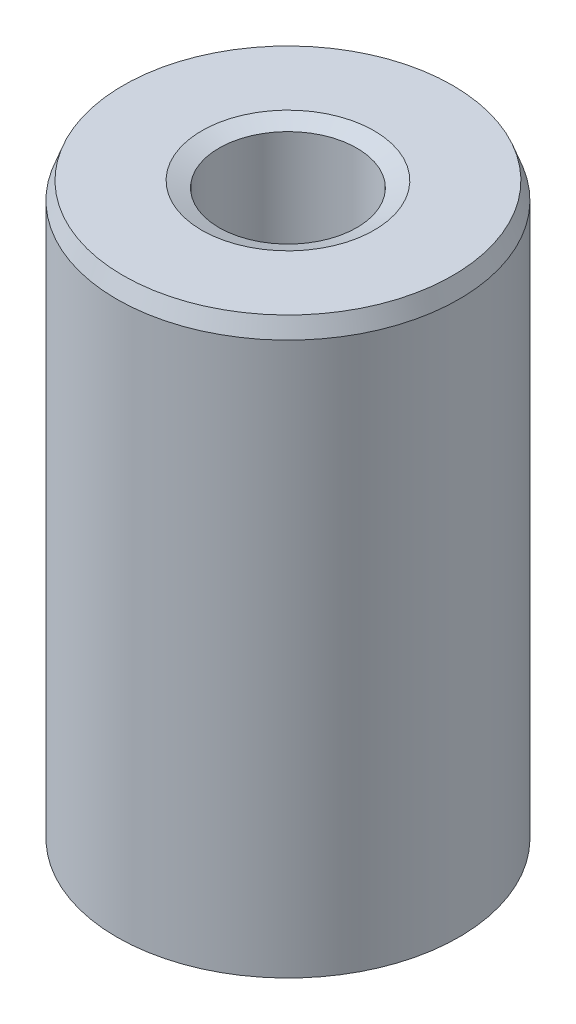
from build123d import *
from OCP.BRepFilletAPI import BRepFilletAPI_MakeChamfer

# Parameters (mm, degrees)
SKETCH1_R           = 25
BOSS_EXTRUDE1_DEPTH = 84.1594414
SKETCH2_R           = 10.069195324
CUT_EXTRUDE1_DEPTH  = 92.284235094
CHAMFER1_SIZE       = 2.524164909
CHAMFER1_SIZE2      = 0.931059133


with BuildPart() as part:
    # Sketch1 → Boss-Extrude1 (new body)
    with BuildSketch(Plane(origin=(0, 0, 0), x_dir=(1, 0, 0), z_dir=(0, 1, 0))):
        Circle(SKETCH1_R)
    extrude(amount=BOSS_EXTRUDE1_DEPTH)

    # Sketch2 → Cut-Extrude1 (cut, through all)
    with BuildSketch(Plane(origin=(0, 0, 0), x_dir=(1, 0, 0), z_dir=(0, 1, 0))):
        Circle(SKETCH2_R)
    extrude(amount=CUT_EXTRUDE1_DEPTH, mode=Mode.SUBTRACT)

    # Chamfer1: one chamfer whose edges measure the first distance from different faces: ONE call of the kernel's chamfer builder (chamfer() names one face for all edges)
    chamfer1_edges_1 = [part.edges().sort_by_distance(p)[0] for p in [
        (-10.069195324, 84.1594414, 0),
    ]]
    chamfer1_side_1 = [part.faces().sort_by_distance(p)[0] for p in [
        (-24.292893219, 84.1594414, 0),
    ]]
    chamfer1_edges_2 = [part.edges().sort_by_distance(p)[0] for p in [
        (-10.069195324, 0, 0),
    ]]
    chamfer1_side_2 = [part.faces().sort_by_distance(p)[0] for p in [
        (-10.069195324, 42.0797207, 0),
    ]]
    chamfer1_edges_3 = [part.edges().sort_by_distance(p)[0] for p in [
        (-25, 0, 0),
    ]]
    chamfer1_side_3 = [part.faces().sort_by_distance(p)[0] for p in [
        (-24.292893219, 0, 0),
    ]]
    chamfer1_edges_4 = [part.edges().sort_by_distance(p)[0] for p in [
        (-25, 84.1594414, 0),
    ]]
    chamfer1_side_4 = [part.faces().sort_by_distance(p)[0] for p in [
        (-25, 42.0797207, 0),
    ]]
    chamfer1 = BRepFilletAPI_MakeChamfer(part.part.solid().wrapped)
    for e in chamfer1_edges_1:
        chamfer1.Add(CHAMFER1_SIZE, CHAMFER1_SIZE2, e.wrapped, chamfer1_side_1[0].wrapped)  # the first distance lies on this face
    for e in chamfer1_edges_2:
        chamfer1.Add(CHAMFER1_SIZE, CHAMFER1_SIZE2, e.wrapped, chamfer1_side_2[0].wrapped)  # the first distance lies on this face
    for e in chamfer1_edges_3:
        chamfer1.Add(CHAMFER1_SIZE, CHAMFER1_SIZE2, e.wrapped, chamfer1_side_3[0].wrapped)  # the first distance lies on this face
    for e in chamfer1_edges_4:
        chamfer1.Add(CHAMFER1_SIZE, CHAMFER1_SIZE2, e.wrapped, chamfer1_side_4[0].wrapped)  # the first distance lies on this face
    add(Compound.cast(chamfer1.Shape()), mode=Mode.REPLACE)


solid = part.part
